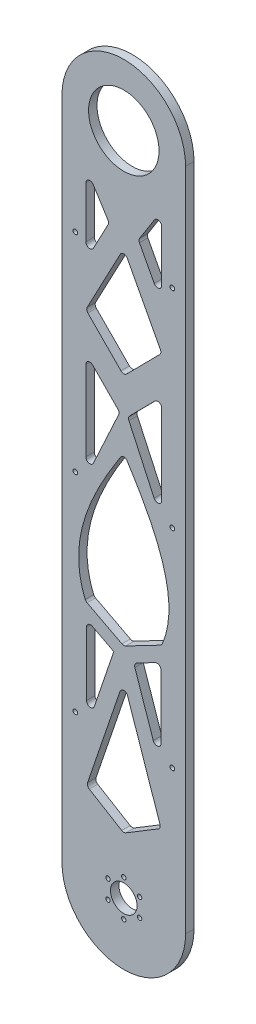
from build123d import *

# Parameters (mm, degrees)
SKETCH2_R           = 10
SKETCH2_R_2         = 1.65
BOSS_EXTRUDE1_DEPTH = 6.35
CUT_EXTRUDE1_DEPTH  = 10
FILLET3_R           = 3
SKETCH5_R           = 1.75
CUT_EXTRUDE2_DEPTH  = 549.511460792
SKETCH6_R           = 26.5
CUT_EXTRUDE3_DEPTH  = 10


with BuildPart() as part:
    # Sketch2 → Boss-Extrude1 (new body)
    with BuildSketch(Plane.XY):
        with BuildLine():
            Line((-46.5, 0), (-46.5, 500))
            ThreePointArc((-46.5, 500), (0, 546.5), (46.5, 500))
            Line((46.5, 500), (46.5, 0))
            ThreePointArc((46.5, 0), (0, -46.5), (-46.5, 0))
        make_face()
        Circle(SKETCH2_R, mode=Mode.SUBTRACT)
        with Locations((0, 13.75)):
            Circle(SKETCH2_R_2, mode=Mode.SUBTRACT)
        with Locations((11.907849302, 6.875)):
            Circle(SKETCH2_R_2, mode=Mode.SUBTRACT)
        with Locations((11.907849302, -6.875)):
            Circle(SKETCH2_R_2, mode=Mode.SUBTRACT)
        with Locations((0, -13.75)):
            Circle(SKETCH2_R_2, mode=Mode.SUBTRACT)
        with Locations((-11.907849302, -6.875)):
            Circle(SKETCH2_R_2, mode=Mode.SUBTRACT)
        with Locations((-11.907849302, 6.875)):
            Circle(SKETCH2_R_2, mode=Mode.SUBTRACT)
    extrude(amount=BOSS_EXTRUDE1_DEPTH)

    # Sketch4 → Cut-Extrude1 (cut)
    with BuildSketch(Plane.XY.offset(6.35)):
        Polygon((28.005258112, 59.37595418), (0, 42.411661153), (-28.005258112, 59.37595418), (0, 141.693437584), align=None)
        Polygon((-7.5, 156.905935087), (-28.005258112, 96.633637735), (-28.005258112, 167.582877854), align=None)
        Polygon((28.005258112, 167.582877854), (7.5, 156.905935087), (28.005258112, 96.633637735), align=None)
        with BuildLine():
            Line((0, 164.275138905), (28.550546746, 179.141206521))
            add(Edge.make_bspline(
                [(28.550546746, 179.141206521), (45.32025339, 216.985654627), (19.430092874, 259.790255689), (0, 290.025756679)],
                knots=[0, 0, 0, 0, 1, 1, 1, 1], degree=3))
            add(Edge.make_bspline(
                [(-28.550546746, 179.141206521), (-45.32025339, 216.985654627), (-19.430092874, 259.790255689), (0, 290.025756679)],
                knots=[0, 0, 0, 0, 1, 1, 1, 1], degree=3))
            Line((-28.550546746, 179.141206521), (0, 164.275138905))
        make_face()
        Polygon((28.550546746, 259.58677623), (3, 314.938284003), (28.550546746, 340.793051053), align=None)
        Polygon((-3, 314.938284003), (-28.550546746, 340.793051053), (-28.550546746, 259.58677623), align=None)
        Polygon((0, 423.142843498), (-28.550546746, 369.246205395), (0, 340.355718526), (28.550546746, 369.246205395), align=None)
        Polygon((-28.550546746, 462.095190817), (-28.550546746, 401.290241252), (-11, 434.421497018), align=None)
        Polygon((28.550546746, 401.290241252), (11, 434.421497018), (28.550546746, 462.095190817), align=None)
    extrude(amount=-CUT_EXTRUDE1_DEPTH, mode=Mode.SUBTRACT)

    # Fillet3
    fillet3_edges = [part.edges().sort_by_distance(p)[0] for p in [
        (-11, 434.421497018, 3.175),
        (-28.550546746, 401.290241252, 3.175),
        (28.550546746, 401.290241252, 3.175),
        (11, 434.421497018, 3.175),
        (28.550546746, 462.095190817, 3.175),
        (-28.550546746, 462.095190817, 3.175),
        (0, 423.142843498, 3.175),
        (-28.550546746, 369.246205395, 3.175),
        (28.550546746, 369.246205395, 3.175),
        (0, 340.355718526, 3.175),
        (28.550546746, 340.793051053, 3.175),
        (-28.550546746, 340.793051053, 3.175),
        (-3, 314.938284003, 3.175),
        (3, 314.938284003, 3.175),
        (28.550546746, 259.58677623, 3.175),
        (-28.550546746, 259.58677623, 3.175),
        (28.550546746, 179.141206521, 3.175),
        (0, 290.025756679, 3.175),
        (-28.550546746, 179.141206521, 3.175),
        (0, 164.275138905, 3.175),
        (-28.005258112, 96.633637735, 3.175),
        (28.005258112, 96.633637735, 3.175),
        (7.5, 156.905935087, 3.175),
        (-28.005258112, 167.582877854, 3.175),
        (28.005258112, 167.582877854, 3.175),
        (0, 141.693437584, 3.175),
        (28.005258112, 59.37595418, 3.175),
        (-28.005258112, 59.37595418, 3.175),
        (0, 42.411661153, 3.175),
    ]]
    fillet(fillet3_edges, radius=FILLET3_R)

    # Sketch5 → Cut-Extrude2 (cut, through all)
    with BuildSketch(Plane.XY.offset(6.35)):
        with Locations((36.5, 103.175)):
            Circle(SKETCH5_R)
        with Locations((-36.5, 103.175)):
            Circle(SKETCH5_R)
        with Locations((36.5, 259.525)):
            Circle(SKETCH5_R)
        with Locations((-36.5, 259.525)):
            Circle(SKETCH5_R)
        with Locations((36.5, 415.875)):
            Circle(SKETCH5_R)
        with Locations((-36.5, 415.875)):
            Circle(SKETCH5_R)
    extrude(amount=-CUT_EXTRUDE2_DEPTH, mode=Mode.SUBTRACT)

    # Sketch6 → Cut-Extrude3 (cut)
    with BuildSketch(Plane.XY.offset(6.35)):
        with Locations((0, 500)):
            Circle(SKETCH6_R)
    extrude(amount=-CUT_EXTRUDE3_DEPTH, mode=Mode.SUBTRACT)


solid = part.part
